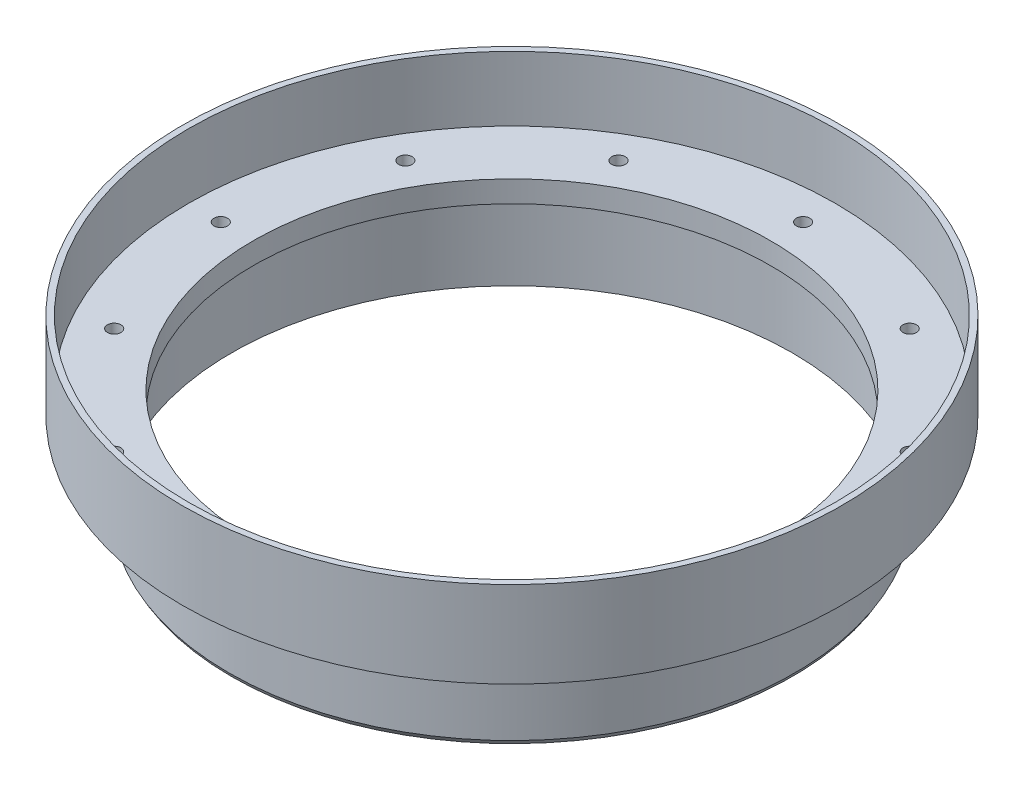
from build123d import *

# Parameters (mm, degrees)
SCREW_HOLES_COUNT = 12


with BuildPart() as part:
    # Cross Section → Main (revolve)
    with BuildSketch(Plane.XY):
        Polygon((-38.1, 0), (-38.1, -3.175), (-41.275, -3.175), (-41.275, -15.875), (-41.656, -15.215088642), (-41.656, -3.175), (-48.514, -3.175), (-48.514, 9.525), (-47.625, 9.525), (-47.625, 0), align=None)
    revolve(axis=Axis((0, 55, 0), (0, -1, 0)))

    # Sketch7 → #3-48 Tapped Hole1 (revolve, cut)
    with BuildSketch(Plane(origin=(-42.8625, 0, 0), x_dir=(0, 0, 1), z_dir=(1, 0, 0))):
        Polygon((0, 0), (0, 3.901027994), (0.99695, 3.302), (0.99695, 0), align=None)
    f_3_48_tapped_hole1 = revolve(axis=Axis((-42.8625, 6.35, 0), (0, -1, 0)), mode=Mode.SUBTRACT)

    # Screw Holes: #3-48 Tapped Hole1 ×12 about axis
    screw_holes_axis = Axis((0, 55, 0), (0, -1, 0))
    for i in range(1, SCREW_HOLES_COUNT):
        add(f_3_48_tapped_hole1.rotate(screw_holes_axis, i * 360 / SCREW_HOLES_COUNT), mode=Mode.SUBTRACT)


solid = part.part
